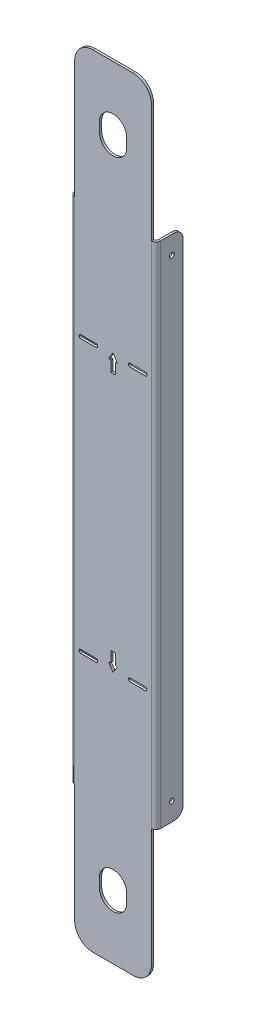
from build123d import *

# Parameters (mm, degrees)
SKETCH1_W                 = 107.15625
SKETCH1_H                 = 1092.2
BASE_FLANGE1_DEPTH        = 3.175
EDGE_FLANGE1_DEPTH        = 711.2
EDGE_FLANGE1_BEND_DEPTH   = 711.2
F_1_4_CLEARANCE_HOLE1_D   = 6.7564
FILLET3_R                 = 12.7
FILLET4_R                 = 25.4
F_1_START                 = -3.175
F_1_1_5_DOWEL_SLOT1_DEPTH = 3.175
SKETCH25_W                = 25.4
SKETCH25_H                = 4.7625
CUT_EXTRUDE1_DEPTH        = 551.697920975
FILLET5_R                 = 0.79375
FILLET6_R                 = 1.5875
FILLET5_OF_MIRROR1_R      = 0.79375
FILLET6_OF_MIRROR1_R      = 1.5875


# Read off the part's stored shape, not the designer's step: 1 (1.5) Dowel Slot1
# Sheet-metal steps are written as plain solids
with BuildPart() as part:
    # Sketch1 → Base-Flange1 (new body)
    with BuildSketch(Plane.XY):
        Rectangle(SKETCH1_W, SKETCH1_H)
    extrude(amount=-BASE_FLANGE1_DEPTH)

    # Edge-Flange1 section (across the edge) → Edge-Flange1 (add)
    with BuildSketch(Plane(origin=(56.753125, 355.6, -3.175), x_dir=(-1, 0, 0), z_dir=(0, -1, 0))):
        with BuildLine():
            Line((-3.175, 3.175), (-3.175, 34.925))
            Line((-3.175, 34.925), (0, 34.925))
            Line((0, 34.925), (0, 3.175))
            ThreePointArc((0, 3.175), (0.92993597, 0.92993597), (3.175, 0))
            Line((3.175, 0), (3.175, -3.175))
            ThreePointArc((3.175, -3.175), (-1.315128061, -1.315128061), (-3.175, 3.175))
        make_face()
    extrude(amount=EDGE_FLANGE1_DEPTH)

    # Edge-Flange1 section 2 (across the edge) → Edge-Flange1 bend (add)
    with BuildSketch(Plane(origin=(-56.753125, -355.6, -3.175), x_dir=(1, 0, 0), z_dir=(0, 1, 0))):
        with BuildLine():
            Line((-3.175, 3.175), (-3.175, 34.925))
            Line((-3.175, 34.925), (0, 34.925))
            Line((0, 34.925), (0, 3.175))
            ThreePointArc((0, 3.175), (0.92993597, 0.92993597), (3.175, 0))
            Line((3.175, 0), (3.175, -3.175))
            ThreePointArc((3.175, -3.175), (-1.315128061, -1.315128061), (-3.175, 3.175))
        make_face()
    extrude(amount=EDGE_FLANGE1_BEND_DEPTH)

    # 1/4 Clearance Hole1 (through all)
    with Locations(Plane(origin=(59.928125, 0, 0), x_dir=(0, 0, -1), z_dir=(1, 0, 0))):
        with Locations((22.225, 330.2), (22.225, -330.2)):
            Hole(F_1_4_CLEARANCE_HOLE1_D / 2)

    # Fillet3
    fillet3_edges = [part.edges().sort_by_distance(p)[0] for p in [
        (58.340625, 355.6, -38.1),
        (58.340625, -355.6, -38.1),
        (-58.340625, -355.6, -38.1),
        (-58.340625, 355.6, -38.1),
    ]]
    fillet(fillet3_edges, radius=FILLET3_R)

    # Fillet4
    fillet4_edges = [part.edges().sort_by_distance(p)[0] for p in [
        (53.578125, -546.1, -1.5875),
        (-53.578125, -546.1, -1.5875),
        (-53.578125, 546.1, -1.5875),
        (53.578125, 546.1, -1.5875),
    ]]
    fillet(fillet4_edges, radius=FILLET4_R)

    # 1 (1.5) Dowel Slot1 outline → 1 (1.5) Dowel Slot1 (cut)
    with BuildSketch(Plane.XY.offset(F_1_START)):
        with BuildLine():
            ThreePointArc((-19.05, 450.85), (0, 431.8), (19.05, 450.85))
            Line((19.05, 450.85), (19.05, 463.55))
            ThreePointArc((19.05, 463.55), (0, 482.6), (-19.05, 463.55))
            Line((-19.05, 463.55), (-19.05, 450.85))
        make_face()
        with BuildLine():
            ThreePointArc((-19.05, -463.55), (0, -482.6), (19.05, -463.55))
            Line((19.05, -463.55), (19.05, -450.85))
            ThreePointArc((19.05, -450.85), (0, -431.8), (-19.05, -450.85))
            Line((-19.05, -450.85), (-19.05, -463.55))
        make_face()
    extrude(amount=F_1_1_5_DOWEL_SLOT1_DEPTH, mode=Mode.SUBTRACT)

    # Sketch25 → Cut-Extrude1 (cut, through all)
    with BuildSketch(Plane.XY):
        with Locations((-34.528125, 190.5)):
            Rectangle(SKETCH25_W, SKETCH25_H)
        Polygon((0, 193.59332287), (6.35, 183.35625), (3.175, 183.35625), (3.175, 168.19332287), (-3.175, 168.19332287), (-3.175, 183.35625), (-6.35, 183.35625), align=None)
        with Locations((34.528125, 190.5)):
            Rectangle(SKETCH25_W, SKETCH25_H)
    cut_extrude1 = extrude(amount=-CUT_EXTRUDE1_DEPTH, mode=Mode.SUBTRACT)

    # Fillet5
    fillet5_edges = [part.edges().sort_by_distance(p)[0] for p in [
        (-6.35, 183.35625, -1.5875),
        (0, 193.59332287, -1.5875),
        (6.35, 183.35625, -1.5875),
        (3.175, 183.35625, -1.5875),
        (3.175, 168.19332287, -1.5875),
        (-3.175, 168.19332287, -1.5875),
        (-3.175, 183.35625, -1.5875),
    ]]
    fillet(fillet5_edges, radius=FILLET5_R)

    # Fillet6
    fillet6_edges = [part.edges().sort_by_distance(p)[0] for p in [
        (-47.228125, 188.11875, -1.5875),
        (-47.228125, 192.88125, -1.5875),
        (-21.828125, 192.88125, -1.5875),
        (-21.828125, 188.11875, -1.5875),
        (47.228125, 192.88125, -1.5875),
        (47.228125, 188.11875, -1.5875),
        (21.828125, 188.11875, -1.5875),
        (21.828125, 192.88125, -1.5875),
    ]]
    fillet(fillet6_edges, radius=FILLET6_R)

    # Mirror1: Cut-Extrude1 across plane
    add(cut_extrude1.mirror(Plane.ZX), mode=Mode.SUBTRACT)

    # Fillet5 of Mirror1
    fillet5_of_mirror1_edges = [part.edges().sort_by_distance(p)[0] for p in [
        (-6.35, -183.35625, -1.5875),
        (0, -193.59332287, -1.5875),
        (6.35, -183.35625, -1.5875),
        (3.175, -183.35625, -1.5875),
        (3.175, -168.19332287, -1.5875),
        (-3.175, -168.19332287, -1.5875),
        (-3.175, -183.35625, -1.5875),
    ]]
    fillet(fillet5_of_mirror1_edges, radius=FILLET5_OF_MIRROR1_R)

    # Fillet6 of Mirror1
    fillet6_of_mirror1_edges = [part.edges().sort_by_distance(p)[0] for p in [
        (-47.228125, -188.11875, -1.5875),
        (-47.228125, -192.88125, -1.5875),
        (-21.828125, -192.88125, -1.5875),
        (-21.828125, -188.11875, -1.5875),
        (47.228125, -192.88125, -1.5875),
        (47.228125, -188.11875, -1.5875),
        (21.828125, -188.11875, -1.5875),
        (21.828125, -192.88125, -1.5875),
    ]]
    fillet(fillet6_of_mirror1_edges, radius=FILLET6_OF_MIRROR1_R)


solid = part.part
